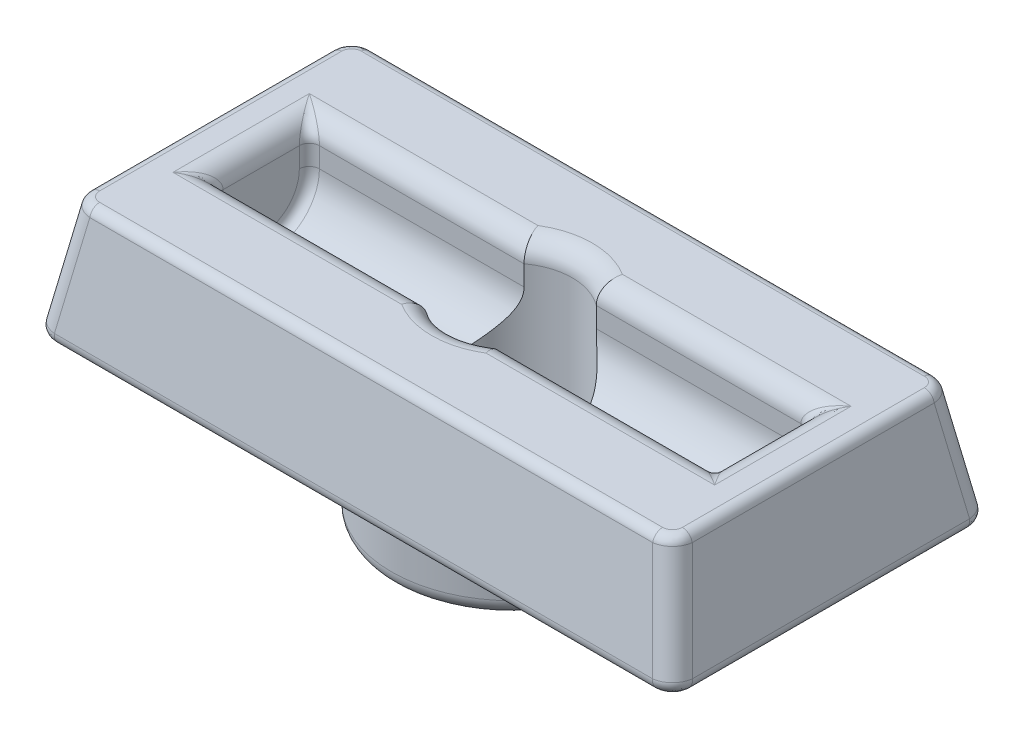
from build123d import *

# Parameters (mm, degrees)
SKETCH1_W           = 16
SKETCH1_H           = 8
EXTRUDE1_DEPTH      = 3
EXTRUDE1_TAPER      = 10
EXTRUDE2_DEPTH      = 6.25
EXTRUDE2_DEPTH_BACK = 6.25
SKETCH4_R           = 3
EXTRUDE4_DEPTH      = 2
SKETCH3_R           = 1.5
EXTRUDE3_DEPTH      = 11.246950883
FILLET1_R           = 0.5
FILLET3_R           = 0.25
FILLET4_R           = 0.4


with BuildPart() as part:
    # Sketch1 → Extrude1 (new body)
    with BuildSketch(Plane(origin=(0, 0, 0), x_dir=(1, 0, 0), z_dir=(0, 1, 0))):
        Rectangle(SKETCH1_W, SKETCH1_H)
    extrude(amount=EXTRUDE1_DEPTH, taper=EXTRUDE1_TAPER)

    # Sketch2 → Extrude2 (cut, two sides: drawn at the far end of the back side and taken through both)
    with BuildSketch(Plane(origin=(0, 0, 0), x_dir=(0, 0, -1), z_dir=(1, 0, 0)).offset(-EXTRUDE2_DEPTH_BACK)):
        with BuildLine():
            Line((-1.2, 2), (-1.2, 3))
            Line((-1.2, 3), (1.2, 3))
            Line((1.2, 3), (1.2, 2))
            ThreePointArc((1.2, 2), (0, 0.8), (-1.2, 2))
        make_face()
    extrude(amount=EXTRUDE2_DEPTH + EXTRUDE2_DEPTH_BACK, mode=Mode.SUBTRACT)

    # Sketch4 → Extrude4 (add)
    with BuildSketch(Plane.XZ):
        Circle(SKETCH4_R)
    extrude(amount=EXTRUDE4_DEPTH)

    # Sketch3 → Extrude3 (cut, through all)
    with BuildSketch(Plane(origin=(0, 3, 0), x_dir=(1, 0, 0), z_dir=(0, 1, 0))):
        Circle(SKETCH3_R)
    extrude(amount=-EXTRUDE3_DEPTH, mode=Mode.SUBTRACT)

    # Fillet1
    fillet1_edges = [part.edges().sort_by_distance(p)[0] for p in [
        (-3.575, 3, -1.2),
        (-6.25, 3, 0),
        (-3.575, 3, 1.2),
        (0, 3, 1.5),
        (3.575, 3, 1.2),
        (6.25, 3, 0),
        (3.575, 3, -1.2),
        (0, 3, -1.5),
        (-7.735509529, 1.5, -3.735509529),
        (-7.735509529, 1.5, 3.735509529),
        (7.735509529, 1.5, 3.735509529),
        (7.735509529, 1.5, -3.735509529),
    ]]
    fillet(fillet1_edges, radius=FILLET1_R)

    # Fillet3
    fillet3_edges = [part.edges().sort_by_distance(p)[0] for p in [
        (-7.327685775, 3, -3.327685775),
        (0, 3, -3.471019058),
        (7.327685775, 3, -3.327685775),
        (7.471019058, 3, 0),
        (7.327685775, 3, 3.327685775),
        (0, 3, 3.471019058),
        (-7.327685775, 3, 3.327685775),
        (6.426975546, 2.881648008, 1.376975546),
        (6.25, 2.25, 1.2),
        (6.426975546, 2.881648008, -1.376975546),
        (6.25, 2.25, -1.2),
        (-6.426975546, 2.881648008, 1.376975546),
        (-6.25, 2.25, 1.2),
        (-6.426975546, 2.881648008, -1.376975546),
        (-6.25, 2.25, -1.2),
        (-7.471019058, 3, 0),
        (6.25, 0.8, 0),
        (-6.25, 0.8, 0),
        (0, 0, 4),
        (7.856666717, 0, 3.856666717),
        (8, 0, 0),
        (7.856666717, 0, -3.856666717),
        (-7.856666717, 0, 3.856666717),
        (-8, 0, 0),
        (-7.856666717, 0, -3.856666717),
        (0, 0, -4),
    ]]
    fillet(fillet3_edges, radius=FILLET3_R)

    # Fillet4
    fillet4_edges = [part.edges().sort_by_distance(p)[0] for p in [
        (-3, -2, 0),
    ]]
    fillet(fillet4_edges, radius=FILLET4_R)


solid = part.part
